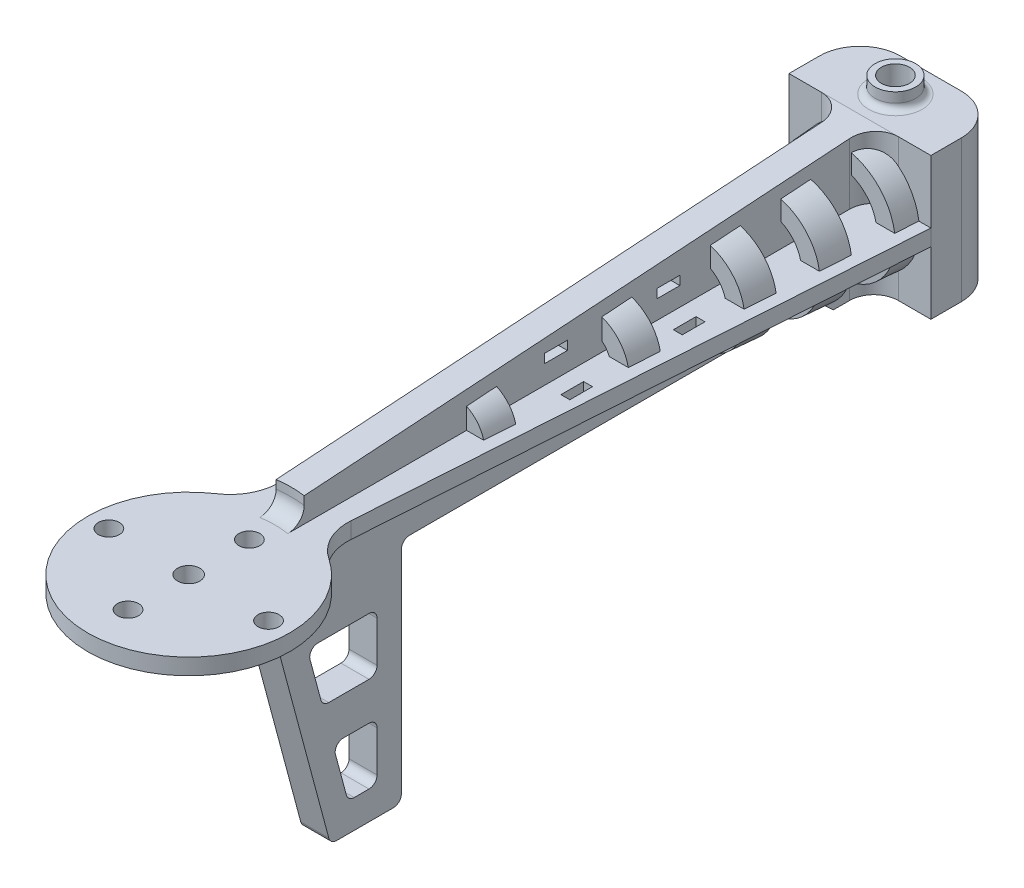
from build123d import *

# Parameters (mm, degrees)
SKETCH1_W                     = 22.225
SKETCH1_H                     = 22.225
BOSS_EXTRUDE1_DEPTH           = 11.1125
SKETCH2_W                     = 3.556
SKETCH2_H                     = 1.397
BOSS_EXTRUDE2_DEPTH           = 2.196041667
SKETCH3_W                     = 1.397
SKETCH3_H                     = 3.556
BOSS_EXTRUDE3_DEPTH           = 1.27
FILLET1_R                     = 6.35
SKETCH5_R                     = 15.8250001
BOSS_EXTRUDE4_DEPTH           = 1.27
SKETCH6_R                     = 13.97
CUT_EXTRUDE2_DEPTH            = 141.551437639
SKETCH25_R                    = 1.749997008
CUT_EXTRUDE8_DEPTH            = 141.551437639
SKETCH26_R                    = 1.6499967
CUT_EXTRUDE9_DEPTH            = 141.551437639
FILLET6_R                     = 7.62
BOSS_EXTRUDE6_REACH           = 141.751
SKETCH22_R                    = 6.35
SKETCH9_R                     = 3.175
BOSS_EXTRUDE5_DEPTH           = 2.54
CBORE_FOR_M3_SHCS1_AT_2_COUNT = 2
CBORE_FOR_M3_SHCS1_AT_2_PITCH = 18.9999874
FILLET9_R                     = 1
SKETCH16_R                    = 2.200000045
CUT_EXTRUDE3_DEPTH            = 146.030300451
SKETCH23_W                    = 31.6500002
SKETCH23_H                    = 25.4
CUT_EXTRUDE6_DEPTH            = 140.750614101
FILLET13_R                    = 3.81
FILLET14_R                    = 3.81
FILLET15_R                    = 3.81
FILLET16_R                    = 3.81
FILLET20_START                = 74.909231635
FILLET20_DEPTH                = 26.19944269
SKETCH28_W                    = 28.2999942
SKETCH28_H                    = 101.6
CUT_EXTRUDE11_DEPTH           = 141.551437776
SKETCH29_R                    = 16.039973
CUT_EXTRUDE12_DEPTH           = 141.551437776
FILLET21_R                    = 2.54


with BuildPart() as part:
    # Sketch1 → Boss-Extrude1 (new body)
    with BuildSketch(Plane.XY):
        Rectangle(SKETCH1_W, SKETCH1_H)
    extrude(amount=BOSS_EXTRUDE1_DEPTH)

    # Sketch2 → Boss-Extrude2 (add, symmetric)
    with BuildSketch(Plane(origin=(0, 0, 0), x_dir=(0, 0, -1), z_dir=(1, 0, 0))):
        with BuildLine():
            Line((-11.1125, 11.1125), (-131.7625, 3.01625))
            Line((-131.7625, 3.01625), (-131.7625, -3.01625))
            Line((-131.7625, -3.01625), (-107.203827092, -6.249460626))
            ThreePointArc((-107.203827092, -6.249460626), (-106.532226171, -6.553759044), (-106.142869557, -7.179895412))
            Line((-106.142869557, -7.179895412), (-96.478931327, -43.246203887))
            ThreePointArc((-96.478931327, -43.246203887), (-96.025332542, -43.925062442), (-95.252205527, -44.1875037))
            Line((-95.252205527, -44.1875037), (-86.384210802, -44.1875037))
            ThreePointArc((-86.384210802, -44.1875037), (-85.48618519, -43.815529312), (-85.114210802, -42.9175037))
            Line((-85.114210802, -42.9175037), (-85.114210802, -9.7574989))
            ThreePointArc((-85.114210802, -9.7574989), (-84.742236414, -8.859473288), (-83.844210802, -8.4874989))
            Line((-83.844210802, -8.4874989), (-20.344210802, -8.4874989))
            Line((-20.344210802, -8.4874989), (-17.4625, -11.1125))
            Line((-17.4625, -11.1125), (-11.1125, -11.1125))
            Line((-11.1125, -11.1125), (-11.1125, 11.1125))
        make_face()
        with Locations((-43.288877469, 4.9110011)):
            Rectangle(SKETCH2_W, SKETCH2_H, mode=Mode.SUBTRACT)
        with Locations((-60.899544135, 4.9110011)):
            Rectangle(SKETCH2_W, SKETCH2_H, mode=Mode.SUBTRACT)
        with BuildLine():
            Line((-88.924210802, -17.1949999), (-88.924210802, -23.5800011))
            ThreePointArc((-88.924210802, -23.5800011), (-89.29618519, -24.478026712), (-90.194210802, -24.8500011))
            Line((-90.194210802, -24.8500011), (-96.489271485, -24.8500011))
            ThreePointArc((-96.489271485, -24.8500011), (-97.2623985, -24.587559842), (-97.715997285, -23.908701287))
            Line((-97.715997285, -23.908701287), (-99.4268532, -17.523700087))
            ThreePointArc((-99.4268532, -17.523700087), (-99.207686143, -16.421872885), (-98.200127401, -15.9249999))
            Line((-98.200127401, -15.9249999), (-90.194210802, -15.9249999))
            ThreePointArc((-90.194210802, -15.9249999), (-89.29618519, -16.296974288), (-88.924210802, -17.1949999))
        make_face(mode=Mode.SUBTRACT)
        with BuildLine():
            Line((-88.924210802, -32.0700019), (-88.924210802, -38.4550031))
            ThreePointArc((-88.924210802, -38.4550031), (-89.29618519, -39.353028712), (-90.194210802, -39.7250031))
            Line((-90.194210802, -39.7250031), (-92.503526712, -39.7250031))
            ThreePointArc((-92.503526712, -39.7250031), (-93.276653727, -39.462561842), (-93.730252511, -38.783703287))
            Line((-93.730252511, -38.783703287), (-95.441108427, -32.398702087))
            ThreePointArc((-95.441108427, -32.398702087), (-95.221941369, -31.296874885), (-94.214382627, -30.8000019))
            Line((-94.214382627, -30.8000019), (-90.194210802, -30.8000019))
            ThreePointArc((-90.194210802, -30.8000019), (-89.29618519, -31.171976288), (-88.924210802, -32.0700019))
        make_face(mode=Mode.SUBTRACT)
    extrude(amount=BOSS_EXTRUDE2_DEPTH, both=True)

    # Sketch3 → Boss-Extrude3 (add, symmetric)
    with BuildSketch(Plane(origin=(0, 0, 0), x_dir=(1, 0, 0), z_dir=(0, 1, 0))):
        Polygon((-11.1125, -11.1125), (11.1125, -11.1125), (3.01625, -131.7625), (-3.01625, -131.7625), align=None)
        with Locations((5.434541667, -43.288877469)):
            Rectangle(SKETCH3_W, SKETCH3_H, mode=Mode.SUBTRACT)
        with Locations((5.434541667, -60.899544135)):
            Rectangle(SKETCH3_W, SKETCH3_H, mode=Mode.SUBTRACT)
        with Locations((-5.434541667, -60.899544135)):
            Rectangle(SKETCH3_W, SKETCH3_H, mode=Mode.SUBTRACT)
        with Locations((-5.434541667, -43.288877469)):
            Rectangle(SKETCH3_W, SKETCH3_H, mode=Mode.SUBTRACT)
    extrude(amount=BOSS_EXTRUDE3_DEPTH, both=True)

    # Fillet1
    fillet1_edges = [part.edges().sort_by_distance(p)[0] for p in [
        (-11.1125, 0, 0),
        (11.1125, 0, 0),
    ]]
    fillet(fillet1_edges, radius=FILLET1_R)

    # Sketch5 → Boss-Extrude4 (add, symmetric)
    with BuildSketch(Plane(origin=(0, 0, 0), x_dir=(1, 0, 0), z_dir=(0, 1, 0))):
        with Locations((0, -116.227608172)):
            Circle(SKETCH5_R)
    extrude(amount=BOSS_EXTRUDE4_DEPTH, both=True)

    # Sketch6 → Cut-Extrude2 (cut, through all)
    with BuildSketch(Plane(origin=(0, 1.27, 0), x_dir=(1, 0, 0), z_dir=(0, 1, 0))):
        with Locations((0, -116.227608172)):
            Circle(SKETCH6_R)
    extrude(amount=CUT_EXTRUDE2_DEPTH, mode=Mode.SUBTRACT)

    # Sketch25 → Cut-Extrude8 (cut, through all)
    with BuildSketch(Plane(origin=(0, 1.27, 0), x_dir=(1, 0, 0), z_dir=(0, 1, 0))):
        with Locations(Location((0, -116.227608172, 0), (0, 0, 270))):
            Circle(SKETCH25_R)
    extrude(amount=-CUT_EXTRUDE8_DEPTH, mode=Mode.SUBTRACT)

    # Sketch26 → Cut-Extrude9 (cut, through all)
    with BuildSketch(Plane(origin=(0, 1.27, 0), x_dir=(1, 0, 0), z_dir=(0, 1, 0))):
        with Locations(Location((12.5000004, -116.227608172, 0), (0, 0, 270))):
            Circle(SKETCH26_R)
        with Locations(Location((-12.5000004, -116.227608172, 0), (0, 0, 90))):
            Circle(SKETCH26_R)
        with Locations(Location((0, -106.727614472, 0), (0, 0, 270))):
            Circle(SKETCH26_R)
        with Locations(Location((0, -125.727601872, 0), (0, 0, 270))):
            Circle(SKETCH26_R)
    extrude(amount=-CUT_EXTRUDE9_DEPTH, mode=Mode.SUBTRACT)

    # Fillet6
    fillet6_edges = [part.edges().sort_by_distance(p)[0] for p in [
        (5.064806073, 0, 101.234997739),
        (-5.064806073, 0, 101.234997739),
    ]]
    fillet(fillet6_edges, radius=FILLET6_R)

    # Boss-Extrude6: up to this plane
    boss_extrude6_end = Plane(origin=(2.196041667, -6.249460626, 107.203827092), z_dir=(0, 0.9914448613738104, -0.13052619222005182))
    # Sketch22 → Boss-Extrude6 (add, up to the surface)
    with BuildSketch(Plane.XZ.offset(1.27), mode=Mode.PRIVATE) as boss_extrude6_sk1:
        with Locations((0, 106.727614472)):
            Circle(SKETCH22_R)
    boss_extrude6_tool1 = split(extrude(boss_extrude6_sk1.sketch, amount=BOSS_EXTRUDE6_REACH, mode=Mode.PRIVATE), bisect_by=boss_extrude6_end, keep=Keep.BOTH, mode=Mode.PRIVATE)
    add(boss_extrude6_tool1.solids().sort_by_distance((0, -1.27, 106.727614))[0])

    # Sketch9 → Boss-Extrude5 (add)
    with BuildSketch(Plane(origin=(0, 11.1125, 0), x_dir=(1, 0, 0), z_dir=(0, 1, 0))):
        with Locations(Location((0, -5.55625, 0), (0, 0, 90))):
            Circle(SKETCH9_R)
    boss_extrude5 = extrude(amount=BOSS_EXTRUDE5_DEPTH)

    # Mirror1: Boss-Extrude5 across plane
    add(boss_extrude5.mirror(Plane.ZX))

    # Sketch14 → CBORE for M3 SHCS1 (revolve, cut)
    with BuildSketch(Plane(origin=(0, -1.27, 125.727601872), x_dir=(0, 0, 1), z_dir=(1, 0, 0))):
        Polygon((0, 0), (0, 42.9175037), (1.7, 42.9175037), (1.7, 13), (3.75, 13), (3.75, 0), align=None)
    cbore_for_m3_shcs1 = revolve(axis=Axis((0, 5.08, 125.727601872), (0, -1, 0)), mode=Mode.SUBTRACT)

    # CBORE for M3 SHCS1 at 2: CBORE for M3 SHCS1 ×2
    with Locations(*[(0, 0, -i * CBORE_FOR_M3_SHCS1_AT_2_PITCH) for i in range(1, CBORE_FOR_M3_SHCS1_AT_2_COUNT)]):
        add(cbore_for_m3_shcs1, mode=Mode.SUBTRACT)

    # Fillet9
    fillet9_edges = [part.edges().sort_by_distance(p)[0] for p in [
        (0, 11.1125, 8.73125),
        (0, -11.1125, 8.73125),
    ]]
    fillet(fillet9_edges, radius=FILLET9_R)

    # Sweep1: sweep along a path in Sketch19
    with BuildLine(Plane.XY.offset(40.216666667)) as sweep1_path:
        CenterArc((0, 0), 20.682824309, 0, 360)
    # Sketch20 → Sweep1 (sweep)
    with BuildSketch(Plane(origin=(0, 0, 0), x_dir=(1, 0, 0), z_dir=(0, 1, 0))):
        Polygon((-5.45589135, -21.016252469), (-8.657951959, -21.016252469), (-8.343156975, -25.707314969), (-5.45589135, -25.707314969), align=None)
        Polygon((-7.917038554, -32.057314969), (-4.714977946, -32.057314969), (-4.714977946, -36.748377469), (-7.602243571, -36.748377469), align=None)
        Polygon((-9.398865364, -9.975189969), (-6.196804755, -9.975189969), (-6.196804755, -14.666252469), (-9.08407038, -14.666252469), align=None)
        Polygon((-5.356244393, -70.218169135), (-2.154183785, -70.218169135), (-2.154183785, -74.909231635), (-5.04144941, -74.909231635), align=None)
        Polygon((-6.777704426, -49.035627469), (-3.575643817, -49.035627469), (-3.575643817, -53.726689969), (-6.462909442, -53.726689969), align=None)
    sweep(path=sweep1_path.line)

    # Sketch16 → Cut-Extrude3 (cut, through all)
    with BuildSketch(Plane(origin=(0, 13.6525, 0), x_dir=(1, 0, 0), z_dir=(0, 1, 0))):
        with Locations(Location((0, -5.55625, 0), (0, 0, 270))):
            Circle(SKETCH16_R)
    extrude(amount=-CUT_EXTRUDE3_DEPTH, mode=Mode.SUBTRACT)

    # Sketch23 → Cut-Extrude6 (cut, through all)
    with BuildSketch(Plane.XZ.offset(1.27)):
        with Locations((0, 128.927608172)):
            Rectangle(SKETCH23_W, SKETCH23_H)
    extrude(amount=CUT_EXTRUDE6_DEPTH, mode=Mode.SUBTRACT)

    # Fillet13
    fillet13_edges = [part.edges().sort_by_distance(p)[0] for p in [
        (-2.196041667, -3.532317301, 11.1125),
    ]]
    fillet(fillet13_edges, radius=FILLET13_R)

    # Fillet14
    # the kernel refuses this fillet: 3.81 mm, written as the material it adds along each edge
    with BuildSketch(Plane(origin=(-2.196041667, -8.255, 11.1125), x_dir=(0, 0, 1), z_dir=(0, 1, 0))) as fillet14_piece_1_section:
        with BuildLine():
            CenterArc((FILLET14_R, -FILLET14_R), FILLET14_R, 90, 90)
            Line((0, -FILLET14_R), (0, 0))
            Line((0, 0), (FILLET14_R, 0))
        make_face()
    fillet14_piece_1 = extrude(amount=23.574634602, mode=Mode.PRIVATE)
    fillet14_piece_1 = split(fillet14_piece_1, bisect_by=Plane(origin=(-2.196041667, 11.1125, 11.1125), z_dir=(0, -1, 0)), keep=Keep.TOP, mode=Mode.PRIVATE)
    fillet14_piece_1 = split(fillet14_piece_1, bisect_by=Plane(origin=(-2.196041667, 11.025676869, 12.406334895), z_dir=(0, -0.9977560176757743, -0.066954680133506)), keep=Keep.TOP, mode=Mode.PRIVATE)
    add(fillet14_piece_1)

    # Fillet15
    # the kernel refuses this fillet: 3.81 mm, written as the material it adds along each edge
    with BuildSketch(Plane(origin=(2.196041667, -8.255, 11.1125), x_dir=(1, 0, 0), z_dir=(0, 1, 0))) as fillet15_piece_1_section:
        with BuildLine():
            CenterArc((FILLET15_R, -FILLET15_R), FILLET15_R, 90, 90)
            Line((0, -FILLET15_R), (0, 0))
            Line((0, 0), (FILLET15_R, 0))
        make_face()
    fillet15_piece_1 = extrude(amount=23.574634602, mode=Mode.PRIVATE)
    fillet15_piece_1 = split(fillet15_piece_1, bisect_by=Plane(origin=(2.196041667, 11.025676869, 12.406334895), z_dir=(0, -0.9977560176757743, -0.066954680133506)), keep=Keep.TOP, mode=Mode.PRIVATE)
    fillet15_piece_1 = split(fillet15_piece_1, bisect_by=Plane(origin=(2.196041667, -1.27, 11.1125), z_dir=(0, 1, 0)), keep=Keep.TOP, mode=Mode.PRIVATE)
    add(fillet15_piece_1)

    # Fillet16
    fillet16_edges = [part.edges().sort_by_distance(p)[0] for p in [
        (2.196041667, -3.532317301, 11.1125),
    ]]
    fillet(fillet16_edges, radius=FILLET16_R)

    # Fillet20: read off the stored shape, not the designer's step
    # Fillet20 outline → Fillet20 (add)
    with BuildSketch(Plane.XY.offset(FILLET20_START)):
        with BuildLine():
            add(Edge.make_bspline(
                [(2.958041667, -1.27), (2.196041667, -1.27), (2.196041667, -2.032)],
                knots=[0, 0, 0, 1, 1, 1], degree=2, weights=[1, 0.707106781, 1]))
            Line((2.958041667, -1.27), (2.196041667, -1.27))
            Line((2.196041667, -1.27), (2.196041667, -2.032))
        make_face()
    extrude(amount=FILLET20_DEPTH)

    # Sketch28 → Cut-Extrude11 (cut, through all)
    with BuildSketch(Plane(origin=(0, 1.27, 0), x_dir=(1, 0, 0), z_dir=(0, 1, 0))):
        with Locations((0, -168.77760518)):
            Rectangle(SKETCH28_W, SKETCH28_H)
    extrude(amount=CUT_EXTRUDE11_DEPTH, mode=Mode.SUBTRACT)

    # Sketch29 → Cut-Extrude12 (cut, through all)
    with BuildSketch(Plane(origin=(0, 1.27, 0), x_dir=(1, 0, 0), z_dir=(0, 1, 0))):
        with Locations((0, -116.227608172)):
            Circle(SKETCH29_R)
    extrude(amount=CUT_EXTRUDE12_DEPTH, mode=Mode.SUBTRACT)

    # Fillet21
    # the kernel refuses this fillet: 2.54 mm, written as the material it adds along each edge
    with BuildSketch(Plane(origin=(0, 1.27, 116.227608172), x_dir=(0.5083199277050048, 0, -0.8611683059065623), z_dir=(0.8611683059065623, 0, 0.5083199277050048))) as fillet21_piece_1_section:
        with BuildLine():
            CenterArc((16.039973 - FILLET21_R, FILLET21_R), FILLET21_R, 270, 90)
            Line((16.039973, FILLET21_R), (16.039973, 0))
            Line((16.039973, 0), (16.039973 - FILLET21_R, 0))
        make_face()
    fillet21_piece_1 = revolve(axis=Axis((0, 1.27, 116.227608172), (0, 1, 0)), revolution_arc=61.103971265, mode=Mode.PRIVATE)
    fillet21_piece_1 = split(fillet21_piece_1, bisect_by=Plane(origin=(-2.196041667, 1.27, 116.227608172), z_dir=(1, 0, 0)), keep=Keep.TOP, mode=Mode.PRIVATE)
    fillet21_piece_1 = split(fillet21_piece_1, bisect_by=Plane(origin=(2.196041667, 1.27, 116.227608172), z_dir=(-1, 0, 0)), keep=Keep.TOP, mode=Mode.PRIVATE)
    add(fillet21_piece_1)


solid = part.part
